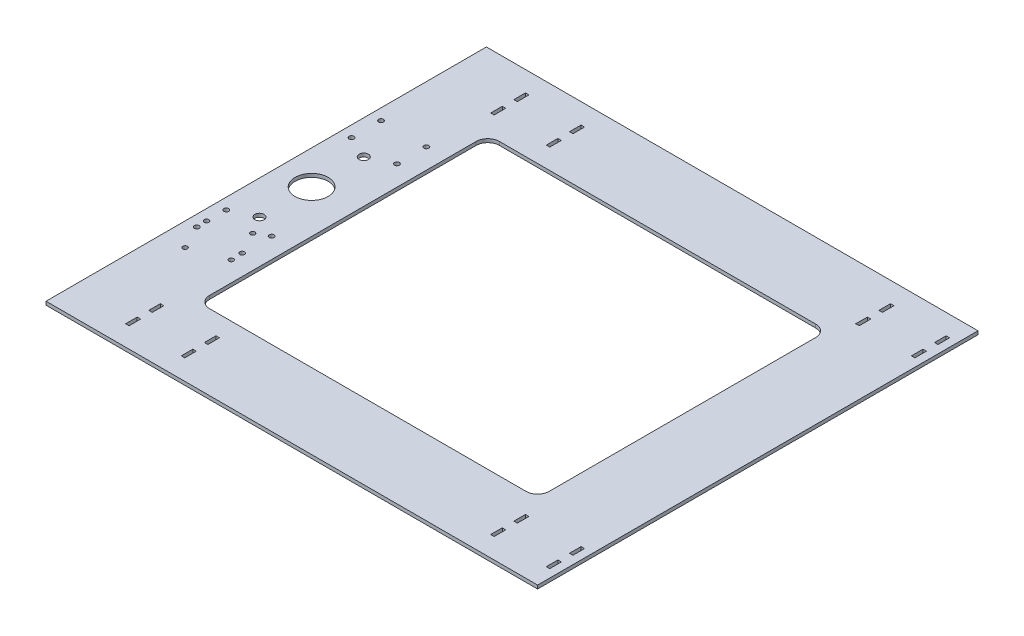
from build123d import *

# Parameters (mm, degrees)
SKETCH1_W           = 424.18
SKETCH1_H           = 380
BOSS_EXTRUDE1_DEPTH = 3
SKETCH2_W           = 250
SKETCH2_H           = 250
CUT_EXTRUDE1_DEPTH  = 285.765110398
SKETCH3_W           = 3
SKETCH3_H           = 10
CUT_EXTRUDE2_DEPTH  = 285.765110398
SKETCH6_R           = 14.2875
SKETCH6_R_2         = 2
SKETCH6_R_3         = 2.083333333
SKETCH6_R_4         = 4
CUT_EXTRUDE3_DEPTH  = 285.765110398
SKETCH7_W           = 88.365074991
SKETCH7_H           = 250
CUT_EXTRUDE4_DEPTH  = 285.765110398
FILLET1_R           = 10


with BuildPart() as part:
    # Sketch1 → Boss-Extrude1 (new body)
    with BuildSketch(Plane(origin=(0, 0, 0), x_dir=(1, 0, 0), z_dir=(0, 1, 0))):
        Rectangle(SKETCH1_W, SKETCH1_H)
    extrude(amount=BOSS_EXTRUDE1_DEPTH)

    # Sketch2 → Cut-Extrude1 (cut, through all)
    with BuildSketch(Plane(origin=(0, 3, 0), x_dir=(1, 0, 0), z_dir=(0, 1, 0))):
        with Locations((22.09, 0)):
            Rectangle(SKETCH2_W, SKETCH2_H)
    extrude(amount=-CUT_EXTRUDE1_DEPTH, mode=Mode.SUBTRACT)

    # Sketch3 → Cut-Extrude2 (cut, through all)
    with BuildSketch(Plane(origin=(0, 3, 0), x_dir=(1, 0, 0), z_dir=(0, 1, 0))):
        with Locations((155.59, -147.5)):
            Rectangle(SKETCH3_W, SKETCH3_H)
        with Locations((155.59, -167.5)):
            Rectangle(SKETCH3_W, SKETCH3_H)
        with Locations((203.59, -147.5)):
            Rectangle(SKETCH3_W, SKETCH3_H)
        with Locations((203.59, -167.5)):
            Rectangle(SKETCH3_W, SKETCH3_H)
        with Locations((-159.41, -147.5)):
            Rectangle(SKETCH3_W, SKETCH3_H)
        with Locations((-159.41, -167.5)):
            Rectangle(SKETCH3_W, SKETCH3_H)
        with Locations((-111.41, -167.5)):
            Rectangle(SKETCH3_W, SKETCH3_H)
        with Locations((-111.41, -147.5)):
            Rectangle(SKETCH3_W, SKETCH3_H)
        with Locations((203.59, 147.5)):
            Rectangle(SKETCH3_W, SKETCH3_H)
        with Locations((203.59, 167.5)):
            Rectangle(SKETCH3_W, SKETCH3_H)
        with Locations((155.59, 167.5)):
            Rectangle(SKETCH3_W, SKETCH3_H)
        with Locations((155.59, 147.5)):
            Rectangle(SKETCH3_W, SKETCH3_H)
        with Locations((-111.41, 147.5)):
            Rectangle(SKETCH3_W, SKETCH3_H)
        with Locations((-111.41, 167.5)):
            Rectangle(SKETCH3_W, SKETCH3_H)
        with Locations((-159.41, 167.5)):
            Rectangle(SKETCH3_W, SKETCH3_H)
        with Locations((-159.41, 147.5)):
            Rectangle(SKETCH3_W, SKETCH3_H)
    extrude(amount=-CUT_EXTRUDE2_DEPTH, mode=Mode.SUBTRACT)

    # Sketch6 → Cut-Extrude3 (cut, through all)
    with BuildSketch(Plane(origin=(0, 3, 0), x_dir=(1, 0, 0), z_dir=(0, 1, 0))):
        with Locations((-182.91, 10)):
            Circle(SKETCH6_R)
        with Locations((-202.793356941, -60.788209542)):
            Circle(SKETCH6_R_2)
        with Locations((-192.137790458, -89.899356941)):
            Circle(SKETCH6_R_2)
        with Locations((-163.026643059, -79.243790458)):
            Circle(SKETCH6_R_2)
        with Locations((-173.682209542, -50.132643059)):
            Circle(SKETCH6_R_2)
        with Locations((-163.345, 64.0505)):
            Circle(SKETCH6_R_3)
        with Locations((-202.475, 64.0505)):
            Circle(SKETCH6_R_3)
        with Locations((-202.475, -44.0505)):
            Circle(SKETCH6_R_3)
        with Locations((-163.345, -44.0505)):
            Circle(SKETCH6_R_3)
        with Locations((-202.475, 89.4505)):
            Circle(SKETCH6_R_3)
        with Locations((-163.345, 89.4505)):
            Circle(SKETCH6_R_3)
        with Locations((-163.345, -69.4505)):
            Circle(SKETCH6_R_3)
        with Locations((-202.475, -69.4505)):
            Circle(SKETCH6_R_3)
        with Locations((-182.91, -35)):
            Circle(SKETCH6_R_4)
        with Locations((-182.91, 55)):
            Circle(SKETCH6_R_4)
    extrude(amount=-CUT_EXTRUDE3_DEPTH, mode=Mode.SUBTRACT)

    # Sketch7 → Cut-Extrude4 (cut, through all)
    with BuildSketch(Plane(origin=(0, 3, 0), x_dir=(1, 0, 0), z_dir=(0, 1, 0))):
        with Locations((-101.709877932, 0)):
            Rectangle(SKETCH7_W, SKETCH7_H)
    extrude(amount=-CUT_EXTRUDE4_DEPTH, mode=Mode.SUBTRACT)

    # Fillet1
    fillet1_edges = [part.edges().sort_by_distance(p)[0] for p in [
        (147.09, 1.5, 125),
        (147.09, 1.5, -125),
        (-145.892415427, 1.5, 125),
        (-145.892415427, 1.5, -125),
    ]]
    fillet(fillet1_edges, radius=FILLET1_R)


solid = part.part
